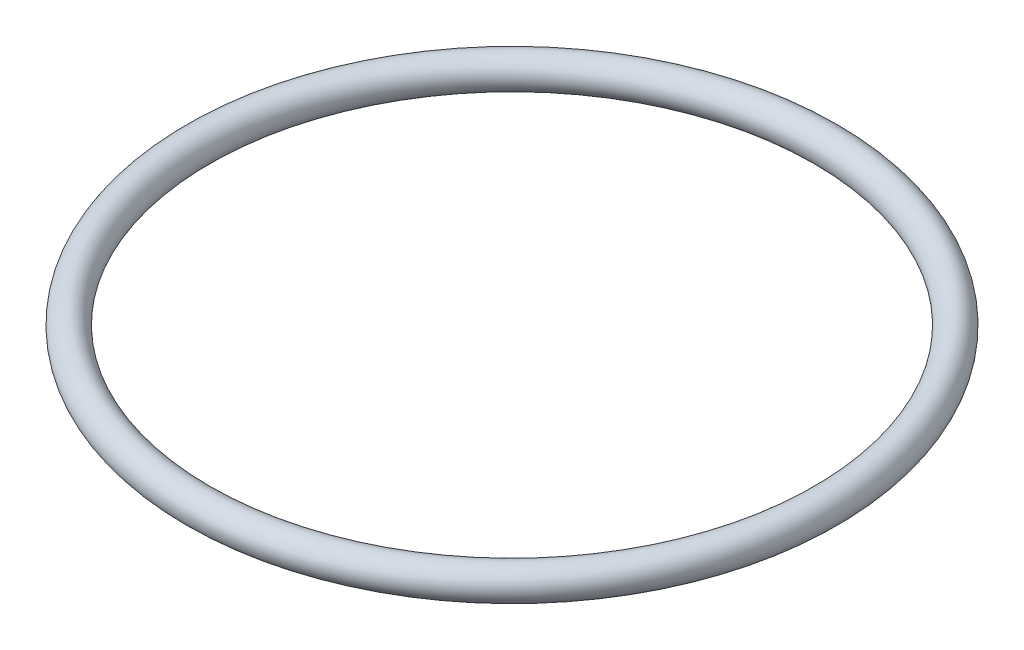
from build123d import *

# Parameters (mm, degrees)
SKETCH1_R = 1.5


with BuildPart() as part:
    # Sketch1 → Revolve1 (revolve)
    with BuildSketch(Plane.XY):
        with Locations((29.25, 0)):
            Circle(SKETCH1_R)
    revolve(axis=Axis((0, 0, 0), (0, 1, 0)))


solid = part.part
